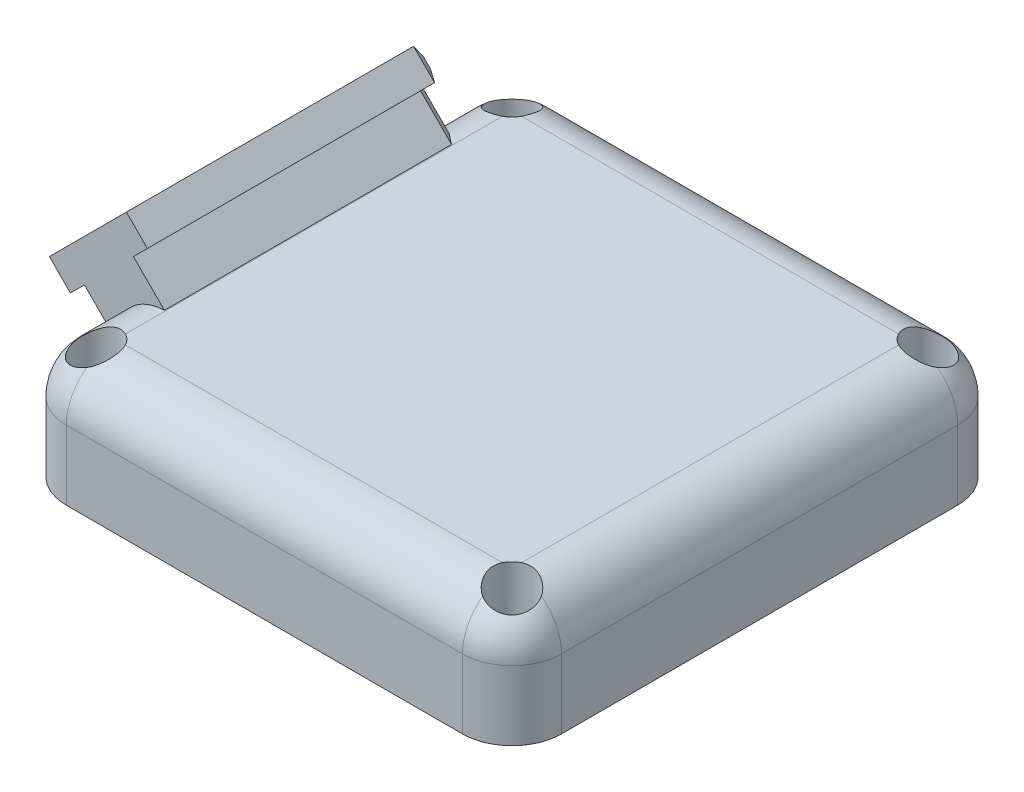
from build123d import *

# Parameters (mm, degrees)
SKETCH1_W                                    = 50
SKETCH1_H                                    = 50
MAIN_BODY_DEPTH                              = 12
SHELL1_T                                     = -2.5
FILLET1_R                                    = 5
SKETCH6_W                                    = 5
SKETCH6_H                                    = 5
SCREW_SUPPORTS_DEPTH                         = 9.5
FILLET2_R                                    = 5
CSK_SLOT_FOR_M2_COUNTERSUNK_FLAT_HEA_2_COUNT = 2
CSK_SLOT_FOR_M2_COUNTERSUNK_FLAT_HEA_2_PITCH = 42
CSK_SLOT_FOR_M2_COUNTERSUNK_FLAT_HEA_3_COUNT = 2
CSK_SLOT_FOR_M2_COUNTERSUNK_FLAT_HEA_3_PITCH = 42
CSK_SLOT_FOR_M2_COUNTERSUNK_FLAT_HEA_4_COUNT = 2
CSK_SLOT_FOR_M2_COUNTERSUNK_FLAT_HEA_4_PITCH = 59.39696962
SKETCH13_W                                   = 13
SKETCH13_H                                   = 26
TOP_CONNECTOR_EXTRUDE_DEPTH                  = 6
SKETCH14_W                                   = 2
SKETCH14_H                                   = 3
DOVETAIL_CUT_DEPTH                           = 51.884673656
FILLET3_R                                    = 2
SKETCH16_W                                   = 8
SKETCH16_H                                   = 3.3
POGO_BODY_CUT_DEPTH                          = 8
SKETCH19_W                                   = 8
SKETCH19_H                                   = 0.6
POGO_BACK_SUPPORT_DEPTH                      = 3.2
SKETCH20_W                                   = 8
SKETCH20_H                                   = 2
POGO_STOPPER_DEPTH                           = 0.6
SKETCH23_W                                   = 15
SKETCH23_H                                   = 40
CUT_EXTRUDE1_DEPTH                           = 38.336309539
BOSS_EXTRUDE1_START                          = -10
BOSS_EXTRUDE1_DEPTH                          = 30
BOSS_EXTRUDE2_DEPTH                          = 30
CHAMFER2_SIZE                                = 1


with BuildPart() as part:
    # Sketch1 → main body (new body)
    with BuildSketch(Plane(origin=(0, 0, 0), x_dir=(1, 0, 0), z_dir=(0, 1, 0))):
        Rectangle(SKETCH1_W, SKETCH1_H)
    extrude(amount=MAIN_BODY_DEPTH)

    # Shell1
    shell1_openings = [part.faces().sort_by_distance(p)[0] for p in [
        (0, 0, 0),
    ]]
    offset(amount=SHELL1_T, openings=shell1_openings, kind=Kind.INTERSECTION)

    # Fillet1
    fillet1_edges = [part.edges().sort_by_distance(p)[0] for p in [
        (25, 12, 0),
        (0, 12, -25),
        (-25, 12, 0),
        (0, 12, 25),
    ]]
    fillet(fillet1_edges, radius=FILLET1_R)

    # Sketch6 → screw supports (add)
    with BuildSketch(Plane.XZ.offset(-9.5)):
        with Locations((20, 20)):
            Rectangle(SKETCH6_W, SKETCH6_H)
        with Locations((-20, 20)):
            Rectangle(SKETCH6_W, SKETCH6_H)
        with Locations((20, -20)):
            Rectangle(SKETCH6_W, SKETCH6_H)
        with Locations((-20, -20)):
            Rectangle(SKETCH6_W, SKETCH6_H)
    extrude(amount=SCREW_SUPPORTS_DEPTH)

    # Fillet2
    # the kernel refuses this fillet: 5 mm, written as the material it takes off along each edge
    with BuildSketch(Plane(origin=(-20, 7, 20), x_dir=(0, 0, 1), z_dir=(-1, 0, 0))) as fillet2_piece_1_section:
        Polygon((0, 0), (FILLET2_R, 0), (FILLET2_R, FILLET2_R), (0, FILLET2_R), align=None)
    fillet2_piece_1 = extrude(amount=FILLET2_R, mode=Mode.PRIVATE)
    fillet2_piece_1 = fillet2_piece_1 - Plane(origin=(-20, 7, 20), x_dir=(0, -0.7071067811865475, -0.7071067811865475), z_dir=(-1, 0, 0)) * Sphere(FILLET2_R, mode=Mode.PRIVATE)
    add(fillet2_piece_1, mode=Mode.SUBTRACT)
    with BuildSketch(Plane(origin=(-20, 7, -20), x_dir=(-1, 0, 0), z_dir=(0, 0, -1))) as fillet2_piece_2_section:
        Polygon((0, 0), (FILLET2_R, 0), (FILLET2_R, FILLET2_R), (0, FILLET2_R), align=None)
    fillet2_piece_2 = extrude(amount=FILLET2_R, mode=Mode.PRIVATE)
    fillet2_piece_2 = fillet2_piece_2 - Plane(origin=(-20, 7, -20), x_dir=(0.7071067811865475, -0.7071067811865475, 0), z_dir=(0, 0, -1)) * Sphere(FILLET2_R, mode=Mode.PRIVATE)
    add(fillet2_piece_2, mode=Mode.SUBTRACT)
    with BuildSketch(Plane(origin=(20, 7, 20), x_dir=(0, 0, 1), z_dir=(1, 0, 0))) as fillet2_piece_3_section:
        Polygon((0, 0), (FILLET2_R, 0), (FILLET2_R, -FILLET2_R), (0, -FILLET2_R), align=None)
    fillet2_piece_3 = extrude(amount=FILLET2_R, mode=Mode.PRIVATE)
    fillet2_piece_3 = fillet2_piece_3 - Plane(origin=(20, 7, 20), x_dir=(0, -0.7071067811865475, -0.7071067811865475), z_dir=(1, 0, 0)) * Sphere(FILLET2_R, mode=Mode.PRIVATE)
    add(fillet2_piece_3, mode=Mode.SUBTRACT)
    with BuildSketch(Plane(origin=(20, 7, -20), x_dir=(1, 0, 0), z_dir=(0, 0, -1))) as fillet2_piece_4_section:
        Polygon((0, 0), (FILLET2_R, 0), (FILLET2_R, -FILLET2_R), (0, -FILLET2_R), align=None)
    fillet2_piece_4 = extrude(amount=FILLET2_R, mode=Mode.PRIVATE)
    fillet2_piece_4 = fillet2_piece_4 - Plane(origin=(20, 7, -20), x_dir=(-0.7071067811865475, -0.7071067811865475, 0), z_dir=(0, 0, -1)) * Sphere(FILLET2_R, mode=Mode.PRIVATE)
    add(fillet2_piece_4, mode=Mode.SUBTRACT)
    with BuildSketch(Plane(origin=(25, -12.5, -25), x_dir=(-1, 0, 0), z_dir=(0, 1, 0)), Plane(origin=(25, -12.5, 25), x_dir=(0, 0, -1), z_dir=(0, 1, 0))) as fillet2_piece_5:
        with BuildLine():
            CenterArc((FILLET2_R, FILLET2_R), FILLET2_R, 180, 90)
            Line((0, FILLET2_R), (0, 0))
            Line((0, 0), (FILLET2_R, 0))
        make_face()
    extrude(amount=19.5, mode=Mode.SUBTRACT)
    with BuildSketch(Plane(origin=(-25, -12.5, -25), x_dir=(1, 0, 0), z_dir=(0, 1, 0)), Plane(origin=(-25, -12.5, 25), x_dir=(0, 0, -1), z_dir=(0, 1, 0))) as fillet2_piece_6:
        with BuildLine():
            CenterArc((FILLET2_R, -FILLET2_R), FILLET2_R, 90, 90)
            Line((0, -FILLET2_R), (0, 0))
            Line((0, 0), (FILLET2_R, 0))
        make_face()
    extrude(amount=19.5, mode=Mode.SUBTRACT)

    # Sketch12 → CSK SLOT for M2 Countersunk Flat Head Screw1 (revolve, cut)
    with BuildSketch(Plane(origin=(-21, 12, -21), x_dir=(0, 0, 1), z_dir=(1, 0, 0))):
        Polygon((0, 0), (0, 12), (1.2, 12), (1.2, 11.5), (2.2, 10.5), (2.2, 0), align=None)
    csk_slot_for_m2_countersunk_flat_head_sc = revolve(axis=Axis((-21, 18.35, -21), (0, -1, 0)), mode=Mode.SUBTRACT)

    # CSK SLOT for M2 Countersunk Flat Hea 2: CSK SLOT for M2 Countersunk Flat Head Screw1 ×2
    with Locations(*[(i * CSK_SLOT_FOR_M2_COUNTERSUNK_FLAT_HEA_2_PITCH, 0, 0) for i in range(1, CSK_SLOT_FOR_M2_COUNTERSUNK_FLAT_HEA_2_COUNT)]):
        add(csk_slot_for_m2_countersunk_flat_head_sc, mode=Mode.SUBTRACT)

    # CSK SLOT for M2 Countersunk Flat Hea 3: CSK SLOT for M2 Countersunk Flat Head Screw1 ×2
    with Locations(*[(0, 0, i * CSK_SLOT_FOR_M2_COUNTERSUNK_FLAT_HEA_3_PITCH) for i in range(1, CSK_SLOT_FOR_M2_COUNTERSUNK_FLAT_HEA_3_COUNT)]):
        add(csk_slot_for_m2_countersunk_flat_head_sc, mode=Mode.SUBTRACT)

    # CSK SLOT for M2 Countersunk Flat Hea 4: CSK SLOT for M2 Countersunk Flat Head Screw1 ×2
    with Locations(*[Vector(0.7071067811865475, 0, 0.7071067811865477) * (i * CSK_SLOT_FOR_M2_COUNTERSUNK_FLAT_HEA_4_PITCH) for i in range(1, CSK_SLOT_FOR_M2_COUNTERSUNK_FLAT_HEA_4_COUNT)]):
        add(csk_slot_for_m2_countersunk_flat_head_sc, mode=Mode.SUBTRACT)

    # Sketch13 → top connector extrude (add)
    with BuildSketch(Plane(origin=(0, 12, 0), x_dir=(1, 0, 0), z_dir=(0, 1, 0))):
        with Locations((0, -2.5)):
            Rectangle(SKETCH13_W, SKETCH13_H)
    extrude(amount=TOP_CONNECTOR_EXTRUDE_DEPTH)

    # Sketch14 → dovetail cut (cut, through all)
    with BuildSketch(Plane.XY.offset(15.5)):
        with Locations((-5.5, 13.5)):
            Rectangle(SKETCH14_W, SKETCH14_H)
        with Locations((5.5, 13.5)):
            Rectangle(SKETCH14_W, SKETCH14_H)
    extrude(amount=-DOVETAIL_CUT_DEPTH, mode=Mode.SUBTRACT)

    # Fillet3
    fillet3_edges = [part.edges().sort_by_distance(p)[0] for p in [
        (0, 18, -10.5),
        (-6.5, 16.5, -10.5),
        (6.5, 16.5, -10.5),
    ]]
    fillet(fillet3_edges, radius=FILLET3_R)

    # Sketch16 → pogo body cut (cut)
    with BuildSketch(Plane(origin=(0, 0, -10.5), x_dir=(-1, 0, 0), z_dir=(0, 0, -1))):
        with Locations((0, 16.35)):
            Rectangle(SKETCH16_W, SKETCH16_H)
    extrude(amount=-POGO_BODY_CUT_DEPTH, mode=Mode.SUBTRACT)

    # Sketch19 → pogo back support (add)
    with BuildSketch(Plane(origin=(0, 0, -2.5), x_dir=(-1, 0, 0), z_dir=(0, 0, -1))):
        with Locations((0, 17.7)):
            Rectangle(SKETCH19_W, SKETCH19_H)
    extrude(amount=POGO_BACK_SUPPORT_DEPTH)

    # Sketch20 → pogo stopper (add)
    with BuildSketch(Plane.XZ.offset(-17.4)):
        with Locations((0, -3.5)):
            Rectangle(SKETCH20_W, SKETCH20_H)
    extrude(amount=POGO_STOPPER_DEPTH)

    # Sketch23 → Cut-Extrude1 (cut, through all)
    with BuildSketch(Plane(origin=(0, 12, 0), x_dir=(1, 0, 0), z_dir=(0, 1, 0))):
        Rectangle(SKETCH23_W, SKETCH23_H)
    extrude(amount=CUT_EXTRUDE1_DEPTH, mode=Mode.SUBTRACT)

    # Sketch27 → Boss-Extrude1 (add)
    with BuildSketch(Plane.XY.offset(25).offset(BOSS_EXTRUDE1_START)):
        Polygon((-28.181980515, 10.181980515), (-23.232233047, 15.131727984), (-20.050252532, 11.949747468), (-25, 7), align=None)
    extrude(amount=-BOSS_EXTRUDE1_DEPTH)

    # Sketch29 → Boss-Extrude2 (add)
    with BuildSketch(Plane.XY.offset(15)):
        Polygon((-31.717514421, 10.889087297), (-23.939339828, 18.66726189), (-21.818019485, 16.545941546), (-29.596194078, 8.767766953), align=None)
    extrude(amount=-BOSS_EXTRUDE2_DEPTH)

    # Chamfer2
    # the kernel refuses this chamfer: 1 mm, written as the material it takes off along each edge
    with BuildSketch(Plane(origin=(-23.18154552, 5.18154552, -15), x_dir=(0.7068394360706733, 0.7068394360706738, -0.027495876610585664), z_dir=(-0.7071067811865477, 0.7071067811865474, 0))) as chamfer2_piece_1_section:
        Polygon((CHAMFER2_SIZE * 0.999621916911, -CHAMFER2_SIZE * 0.0274958766106), (-CHAMFER2_SIZE * 0.0274958766106, -CHAMFER2_SIZE * 0.999621916911), (0, 0), align=None)
    chamfer2_piece_1 = extrude(amount=7.071682988, mode=Mode.PRIVATE)
    chamfer2_piece_1 = chamfer2_piece_1 - Plane(origin=(-20, 7, -14.821451395), x_dir=(-1, 0, 0), z_dir=(0, 0, 1)) * Cylinder(5, 19, mode=Mode.PRIVATE)
    add(chamfer2_piece_1, mode=Mode.SUBTRACT)
    with BuildSketch(Plane(origin=(-23.232233047, 15.131727984, -15), x_dir=(-0.7068394360706741, -0.7068394360706729, -0.027495876610583902), z_dir=(0.7071067811865469, -0.7071067811865481, 0))) as chamfer2_piece_2_section:
        Polygon((CHAMFER2_SIZE * 0.999621916911, -CHAMFER2_SIZE * 0.0274958766106), (-CHAMFER2_SIZE * 0.0274958766106, -CHAMFER2_SIZE * 0.999621916911), (0, 0), align=None)
    chamfer2_piece_2 = extrude(amount=7.002015834, mode=Mode.PRIVATE)
    chamfer2_piece_2 = chamfer2_piece_2 - Plane(origin=(-20, 7, -14.663806986), x_dir=(-1, 0, 0), z_dir=(0, 0, 1)) * Cylinder(5, 19, mode=Mode.PRIVATE)
    add(chamfer2_piece_2, mode=Mode.SUBTRACT)
    with BuildSketch(Plane(origin=(-27.777739598, 6.949312473, -15), x_dir=(-0.01944252080601335, -0.0194425208060134, 0.9996219169112968), z_dir=(-0.7071067811865485, 0.7071067811865467, 0)), Plane(origin=(-25.757794308, 20.485716369, -15), x_dir=(0.019442520806015502, 0.019442520806015565, 0.9996219169112968), z_dir=(0.7071067811865487, -0.7071067811865464, 0))) as chamfer2_piece_3:
        Polygon((CHAMFER2_SIZE * 0.999621916911, CHAMFER2_SIZE * 0.0274958766106), (-CHAMFER2_SIZE * 0.0274958766106, CHAMFER2_SIZE * 0.999621916911), (0, 0), align=None)
    extrude(amount=8.143365976, mode=Mode.SUBTRACT)
    with BuildSketch(Plane(origin=(-33.535968901, 9.070632817, -15), x_dir=(-0.01944252080601553, 0.019442520806015537, 0.9996219169112968), z_dir=(0.7071067811865477, 0.7071067811865474, 0))) as chamfer2_piece_4:
        Polygon((CHAMFER2_SIZE * 0.999621916911, CHAMFER2_SIZE * 0.0274958766106), (-CHAMFER2_SIZE * 0.0274958766106, CHAMFER2_SIZE * 0.999621916911), (0, 0), align=None)
    extrude(amount=16.143365976, mode=Mode.SUBTRACT)
    with BuildSketch(Plane(origin=(-19.999565005, 18.364396026, -15), x_dir=(-0.7068394360706738, 0.7068394360706733, -0.0274958766105857), z_dir=(-0.7071067811865474, -0.7071067811865478, 0)), Plane(origin=(-28.181980515, 10.181980515, -15), x_dir=(-0.7068394360706738, 0.7068394360706733, -0.027495876610585664), z_dir=(-0.7071067811865474, -0.7071067811865478, 0))) as chamfer2_piece_5:
        Polygon((CHAMFER2_SIZE * 0.999621916911, -CHAMFER2_SIZE * 0.0274958766106), (-CHAMFER2_SIZE * 0.0274958766106, -CHAMFER2_SIZE * 0.999621916911), (0, 0), align=None)
    extrude(amount=4.571682988, mode=Mode.SUBTRACT)
    with BuildSketch(Plane(origin=(-23.18154552, 5.18154552, -15), x_dir=(0.7068394360706733, 0.7068394360706738, -0.027495876610585664), z_dir=(-0.7071067811865477, 0.7071067811865474, 0))) as chamfer2_piece_6a_section:
        Polygon((CHAMFER2_SIZE * 0.999621916911, -CHAMFER2_SIZE * 0.0274958766106), (-CHAMFER2_SIZE * 0.0274958766106, -CHAMFER2_SIZE * 0.999621916911), (0, 0), align=None)
    chamfer2_piece_6a = extrude(amount=9.643365976, mode=Mode.PRIVATE)
    chamfer2_piece_6a = split(chamfer2_piece_6a, bisect_by=Plane(origin=(-27.948781205, 10.415179825, -14.670206373), z_dir=(-0.7071067811865478, 0.7071067811865474, 0)), keep=Keep.TOP, mode=Mode.PRIVATE)
    with BuildSketch(Plane(origin=(-26.363526035, 12.000434995, -15), x_dir=(-0.7068394360706738, 0.7068394360706733, -0.027495876610585664), z_dir=(-0.7071067811865474, -0.7071067811865478, 0))) as chamfer2_piece_6b_section:
        Polygon((CHAMFER2_SIZE * 0.999621916911, -CHAMFER2_SIZE * 0.0274958766106), (-CHAMFER2_SIZE * 0.0274958766106, -CHAMFER2_SIZE * 0.999621916911), (0, 0), align=None)
    chamfer2_piece_6b = extrude(amount=7.143365976, mode=Mode.PRIVATE)
    chamfer2_piece_6b = split(chamfer2_piece_6b, bisect_by=Plane(origin=(-28.415179825, 10.415179825, -14.670206373), z_dir=(0.7071067811865474, 0.7071067811865477, 0)), keep=Keep.TOP, mode=Mode.PRIVATE)
    chamfer2_piece_6 = chamfer2_piece_6a & chamfer2_piece_6b
    add(chamfer2_piece_6, mode=Mode.SUBTRACT)
    with BuildSketch(Plane(origin=(-19.999565005, 18.364396026, -15), x_dir=(-0.7068394360706738, 0.7068394360706733, -0.0274958766105857), z_dir=(-0.7071067811865474, -0.7071067811865478, 0))) as chamfer2_piece_7a_section:
        Polygon((CHAMFER2_SIZE * 0.999621916911, -CHAMFER2_SIZE * 0.0274958766106), (-CHAMFER2_SIZE * 0.0274958766106, -CHAMFER2_SIZE * 0.999621916911), (0, 0), align=None)
    chamfer2_piece_7a = extrude(amount=7.143365976, mode=Mode.PRIVATE)
    chamfer2_piece_7a = split(chamfer2_piece_7a, bisect_by=Plane(origin=(-23.465432357, 15.364927294, -14.670206373), z_dir=(-0.7071067811865481, -0.7071067811865469, 0)), keep=Keep.TOP, mode=Mode.PRIVATE)
    with BuildSketch(Plane(origin=(-25.050687527, 16.950182463, -15), x_dir=(-0.7068394360706741, -0.7068394360706729, -0.02749587661058563), z_dir=(0.7071067811865469, -0.7071067811865481, 0))) as chamfer2_piece_7b_section:
        Polygon((CHAMFER2_SIZE * 0.999621916911, -CHAMFER2_SIZE * 0.0274958766106), (-CHAMFER2_SIZE * 0.0274958766106, -CHAMFER2_SIZE * 0.999621916911), (0, 0), align=None)
    chamfer2_piece_7b = extrude(amount=9.573698822, mode=Mode.PRIVATE)
    chamfer2_piece_7b = split(chamfer2_piece_7b, bisect_by=Plane(origin=(-23.465432357, 14.898528674, -14.670206373), z_dir=(-0.7071067811865478, 0.7071067811865474, 0)), keep=Keep.TOP, mode=Mode.PRIVATE)
    chamfer2_piece_7 = chamfer2_piece_7a & chamfer2_piece_7b
    add(chamfer2_piece_7, mode=Mode.SUBTRACT)


solid = part.part
